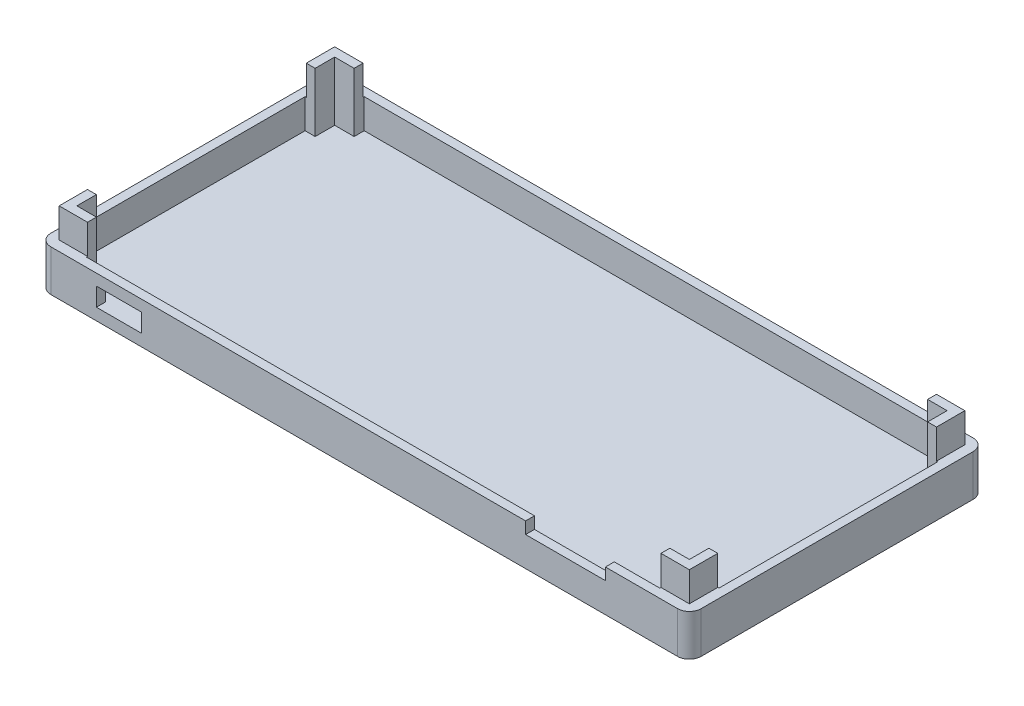
from build123d import *

# Parameters (mm, degrees)
STOCK_FULL_SHAPE_1_OUTLINE_W     = 110
STOCK_FULL_SHAPE_1_OUTLINE_H     = 50
STOCK_FULL_SHAPE_1_DEPTH         = 2
STOCK_FULL_START                 = 2
STOCK_FULL_SHAPE_1_2_OUTLINE_W   = 110
STOCK_FULL_SHAPE_1_2_OUTLINE_H   = 50
STOCK_FULL_SHAPE_1_2_OUTLINE_W_2 = 107
STOCK_FULL_SHAPE_1_2_OUTLINE_H_2 = 47
STOCK_FULL_SHAPE_1_2_DEPTH       = 3
BOSS_EXTRUDE1_DEPTH              = 10
BOSS_EXTRUDE2_DEPTH              = 10
BOSS_EXTRUDE3_DEPTH              = 10
BOSS_EXTRUDE4_DEPTH              = 10
CUT_EXTRUDE3_DEPTH               = 7
SKETCH9_W                        = 106.6
SKETCH9_H                        = 2
CUT_EXTRUDE4_DEPTH               = 87
SKETCH10_W                       = 7.6
SKETCH10_H                       = 1.5
CUT_EXTRUDE5_DEPTH               = 3
SKETCH11_W                       = 110
SKETCH11_H                       = 50
BOSS_EXTRUDE5_DEPTH              = 2
BOSS_EXTRUDE6_DEPTH              = 2
SKETCH13_W                       = 7.6
SKETCH13_H                       = 1.5
CUT_EXTRUDE6_DEPTH               = 0.1
SKETCH1_W                        = 13.5
SKETCH1_H                        = 1.5
CUT_EXTRUDE7_DEPTH               = 10.1
FILLET1_R                        = 2


# Read off the part's stored shape, not the designer's step: Stock-full shape-1
with BuildPart() as part:
    # Stock-full shape-1 outline → Stock-full shape-1 (new body)
    with BuildSketch(Plane(origin=(0, 0, 0), x_dir=(1, 0, 0), z_dir=(0, 1, 0))):
        with Locations((14.090909091, -5.886363636)):
            Rectangle(STOCK_FULL_SHAPE_1_OUTLINE_W, STOCK_FULL_SHAPE_1_OUTLINE_H)
    extrude(amount=STOCK_FULL_SHAPE_1_DEPTH)

    # Stock-full shape-1 2 outline → Stock-full shape-1 2 (add)
    with BuildSketch(Plane(origin=(0, 0, 0), x_dir=(1, 0, 0), z_dir=(0, 1, 0)).offset(STOCK_FULL_START)):
        with Locations((14.090909091, -5.886363636)):
            Rectangle(STOCK_FULL_SHAPE_1_2_OUTLINE_W, STOCK_FULL_SHAPE_1_2_OUTLINE_H)
        with Locations((14.090909091, -5.886363636)):
            Rectangle(STOCK_FULL_SHAPE_1_2_OUTLINE_W_2, STOCK_FULL_SHAPE_1_2_OUTLINE_H_2, mode=Mode.SUBTRACT)
    extrude(amount=STOCK_FULL_SHAPE_1_2_DEPTH)

    # Sketch4 → Boss-Extrude1 (add)
    with BuildSketch(Plane(origin=(0, 2, 0), x_dir=(1, 0, 0), z_dir=(0, 1, 0))):
        Polygon((-39.409090909, 12.824440082), (-39.409090909, 17.613636364), (-34.409090909, 17.613636364), (-34.409090909, 15.913636364), (-37.709090909, 15.913636364), (-37.709090909, 12.613636364), (-39.409090909, 12.613636364), align=None)
    extrude(amount=BOSS_EXTRUDE1_DEPTH)

    # Sketch5 → Boss-Extrude2 (add)
    with BuildSketch(Plane(origin=(0, 2, 0), x_dir=(1, 0, 0), z_dir=(0, 1, 0))):
        Polygon((-39.409090909, -29.386363636), (-39.409090909, -24.386363636), (-37.709090909, -24.386363636), (-37.709090909, -27.686363636), (-34.409090909, -27.686363636), (-34.409090909, -29.386363636), align=None)
    extrude(amount=BOSS_EXTRUDE2_DEPTH)

    # Sketch6 → Boss-Extrude3 (add)
    with BuildSketch(Plane(origin=(0, 2, 0), x_dir=(1, 0, 0), z_dir=(0, 1, 0))):
        Polygon((67.590909091, 17.613636364), (62.590909091, 17.613636364), (62.590909091, 15.913636364), (65.890909091, 15.913636364), (65.890909091, 12.613636364), (67.590909091, 12.613636364), align=None)
    extrude(amount=BOSS_EXTRUDE3_DEPTH)

    # Sketch7 → Boss-Extrude4 (add)
    with BuildSketch(Plane(origin=(0, 2, 0), x_dir=(1, 0, 0), z_dir=(0, 1, 0))):
        Polygon((67.590909091, -24.386363636), (67.590909091, -29.386363636), (62.590909091, -29.386363636), (62.590909091, -27.686363636), (65.890909091, -27.686363636), (65.890909091, -24.386363636), align=None)
    extrude(amount=BOSS_EXTRUDE4_DEPTH)

    # Sketch8 → Cut-Extrude3 (cut)
    with BuildSketch(Plane(origin=(0, 12, 0), x_dir=(1, 0, 0), z_dir=(0, 1, 0))):
        Polygon((62.590909091, -29.386363636), (62.590909091, -29.186363636), (67.390909091, -29.186363636), (67.390909091, -24.386363636), (67.590909091, -24.386363636), (67.590909091, -29.386363636), align=None)
        Polygon((62.590909091, 17.613636364), (62.590909091, 17.413636364), (67.390909091, 17.413636364), (67.390909091, 12.613636364), (67.590909091, 12.613636364), (67.590909091, 17.613636364), align=None)
        Polygon((-39.409090909, 12.613636364), (-39.409090909, 17.613636364), (-34.409090909, 17.613636364), (-34.409090909, 17.413636364), (-39.209090909, 17.413636364), (-39.209090909, 12.613636364), align=None)
        Polygon((-39.409090909, -24.386363636), (-39.409090909, -29.386363636), (-34.409090909, -29.386363636), (-34.409090909, -29.186363636), (-39.209090909, -29.186363636), (-39.209090909, -24.386363636), align=None)
    extrude(amount=-CUT_EXTRUDE3_DEPTH, mode=Mode.SUBTRACT)

    # Sketch9 → Cut-Extrude4 (cut)
    with BuildSketch(Plane.XY.offset(29.186363636)):
        with Locations((14.090909091, 11)):
            Rectangle(SKETCH9_W, SKETCH9_H)
    extrude(amount=-CUT_EXTRUDE4_DEPTH, mode=Mode.SUBTRACT)

    # Sketch10 → Cut-Extrude5 (cut)
    with BuildSketch(Plane(origin=(0, 5, 0), x_dir=(1, 0, 0), z_dir=(0, 1, 0))):
        with Locations((-27.409090909, -30.136363636)):
            Rectangle(SKETCH10_W, SKETCH10_H)
    extrude(amount=-CUT_EXTRUDE5_DEPTH, mode=Mode.SUBTRACT)

    # Sketch11 → Boss-Extrude5 (add)
    with BuildSketch(Plane(origin=(0, 5, 0), x_dir=(1, 0, 0), z_dir=(0, 1, 0))):
        with Locations((14.090909091, -5.886363636)):
            Rectangle(SKETCH11_W, SKETCH11_H)
        Polygon((-39.209090909, 17.413636364), (-39.209090909, 12.613636364), (-39.409090909, 12.613636364), (-39.409090909, -24.386363636), (-39.209090909, -24.386363636), (-39.209090909, -29.186363636), (-34.409090909, -29.186363636), (-34.409090909, -29.386363636), (-31.209090909, -29.386363636), (62.590909091, -29.386363636), (62.590909091, -29.186363636), (67.390909091, -29.186363636), (67.390909091, -24.386363636), (67.590909091, -24.386363636), (67.590909091, 12.613636364), (67.390909091, 12.613636364), (67.390909091, 17.413636364), (62.590909091, 17.413636364), (62.590909091, 17.613636364), (-34.409090909, 17.613636364), (-34.409090909, 17.413636364), align=None, mode=Mode.SUBTRACT)
    extrude(amount=BOSS_EXTRUDE5_DEPTH)

    # Sketch12 → Boss-Extrude6 (add)
    with BuildSketch(Plane(origin=(0, 10, 0), x_dir=(1, 0, 0), z_dir=(0, 1, 0))):
        Polygon((-37.709090909, -24.386363636), (-39.209090909, -24.386363636), (-39.209090909, -29.186363636), (-34.409090909, -29.186363636), (-34.409090909, -27.686363636), (-37.709090909, -27.686363636), align=None)
        Polygon((62.590909091, -29.186363636), (67.390909091, -29.186363636), (67.390909091, -24.386363636), (65.890909091, -24.386363636), (65.890909091, -27.686363636), (62.590909091, -27.686363636), align=None)
        Polygon((67.390909091, 12.613636364), (65.890909091, 12.613636364), (65.890909091, 15.913636364), (62.590909091, 15.913636364), (62.590909091, 17.413636364), (67.390909091, 17.413636364), align=None)
        Polygon((-37.709090909, 12.613636364), (-39.209090909, 12.613636364), (-39.209090909, 17.413636364), (-34.409090909, 17.413636364), (-34.409090909, 15.913636364), (-37.709090909, 15.913636364), align=None)
    extrude(amount=BOSS_EXTRUDE6_DEPTH)

    # Sketch13 → Cut-Extrude6 (cut)
    with BuildSketch(Plane.XZ.offset(-5)):
        with Locations((-27.409090909, 30.136363636)):
            Rectangle(SKETCH13_W, SKETCH13_H)
    extrude(amount=-CUT_EXTRUDE6_DEPTH, mode=Mode.SUBTRACT)

    # Sketch1 → Cut-Extrude7 (cut)
    with BuildSketch(Plane(origin=(0, 5, 0), x_dir=(1, 0, 0), z_dir=(0, 1, 0))):
        with Locations((48.140909091, -30.136363636)):
            Rectangle(SKETCH1_W, SKETCH1_H)
    extrude(amount=CUT_EXTRUDE7_DEPTH, mode=Mode.SUBTRACT)

    # Fillet1
    fillet1_edges = [part.edges().sort_by_distance(p)[0] for p in [
        (-40.909090909, 2.5, -19.113636364),
        (69.090909091, 2.5, -19.113636364),
        (69.090909091, 2.5, 30.886363636),
        (-40.909090909, 2.5, 30.886363636),
    ]]
    fillet(fillet1_edges, radius=FILLET1_R)


solid = part.part
